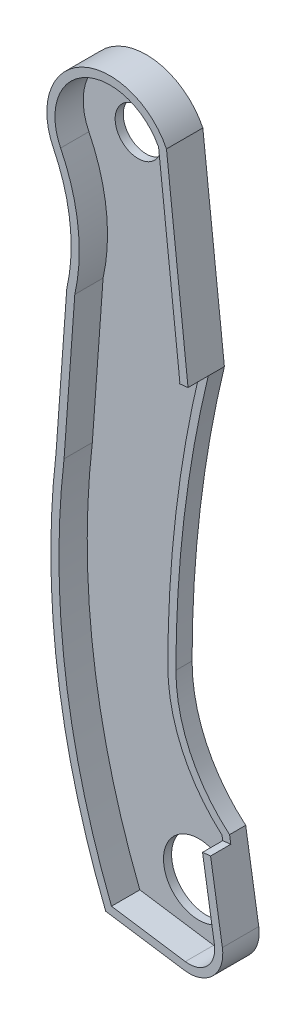
from build123d import *

# Parameters (mm, degrees)
BOSS_EXTRUDE1_DEPTH = 3.429
FILLET1_R           = 3.175
SHELL1_START        = 0.762
SHELL1_DEPTH        = 2.667
SKETCH2_R           = 2.1717
SKETCH2_R_2         = 3.3274
CUT_EXTRUDE1_DEPTH  = 109.116950745
SKETCH4_W           = 1.905
SKETCH4_H           = 37.1856
CUT_EXTRUDE3_DEPTH  = 8.509


# Read off the part's stored shape, not the designer's step: Shell1
with BuildPart() as part:
    # Sketch1 → Boss-Extrude1 (new body)
    with BuildSketch(Plane.XY):
        with BuildLine():
            Line((62.694975666, 80.659735828), (64.726975666, 62.193935828))
            ThreePointArc((64.726975666, 62.193935828), (62.449213934, 49.504733029), (61.678975666, 36.635747087))
            ThreePointArc((61.678975666, 36.635747087), (63.002494237, 30.6317877), (66.736169072, 25.747230203))
            Line((66.736169072, 25.747230203), (68.652274874, 13.809230203))
            Line((68.652274874, 13.809230203), (56.968274874, 15.553747087))
            ThreePointArc((56.968274874, 15.553747087), (52.42740055, 32.785925059), (52.280975666, 50.605747087))
            Line((52.280975666, 50.605747087), (53.296975666, 64.575747087))
            ThreePointArc((53.296975666, 64.575747087), (53.599423451, 70.100985632), (52.031009659, 75.407567754))
            ThreePointArc((52.031009659, 75.407567754), (54.734890855, 83.369731663), (62.694975666, 80.659735828))
        make_face()
    extrude(amount=BOSS_EXTRUDE1_DEPTH)

    # Fillet1
    fillet1_edges = [part.edges().sort_by_distance(p)[0] for p in [
        (68.652274874, 13.809230203, 1.7145),
    ]]
    fillet(fillet1_edges, radius=FILLET1_R)

    # Shell1 outline → Shell1 (cut)
    with BuildSketch(Plane.XY.offset(SHELL1_START)):
        with BuildLine():
            ThreePointArc((61.952685119, 80.438826605), (55.013786801, 82.65723656), (52.714338634, 75.744770233))
            ThreePointArc((52.714338634, 75.744770233), (54.352815027, 70.218797874), (54.052777411, 64.462848531))
            Line((54.052777411, 64.462848531), (53.039751684, 50.533744782))
            ThreePointArc((53.039751684, 50.533744782), (53.153060273, 33.111126197), (57.513949579, 16.242720176))
            Line((57.513949579, 16.242720176), (64.473451012, 15.203609619))
            ThreePointArc((64.473451012, 15.203609619), (66.545332993, 15.893259626), (67.212288081, 17.972558303))
            Line((67.212288081, 17.972558303), (66.027992544, 25.351127953))
            ThreePointArc((66.027992544, 25.351127953), (62.25173003, 30.440896905), (60.916975951, 36.636406417))
            ThreePointArc((60.916975951, 36.636406417), (61.6846952, 49.528718986), (63.955003411, 62.242759133))
            Line((63.955003411, 62.242759133), (61.952685119, 80.438826605))
        make_face()
    extrude(amount=SHELL1_DEPTH, mode=Mode.SUBTRACT)

    # Sketch2 → Cut-Extrude1 (cut, through all)
    with BuildSketch(Plane.XY.offset(3.429)):
        with Locations((57.360975666, 78.037747087)):
            Circle(SKETCH2_R)
        with Locations((63.072884184, 19.881317109)):
            Circle(SKETCH2_R_2)
    extrude(amount=-CUT_EXTRUDE1_DEPTH, mode=Mode.SUBTRACT)

    # Sketch4 → Cut-Extrude3 (cut)
    with BuildSketch(Plane(origin=(70.714586477, 7.781522583, 0), x_dir=(0, 0, -1), z_dir=(0.9939998970848155, 0.1093810065567881, 0))):
        with Locations((-2.4765, 36.148064063)):
            Rectangle(SKETCH4_W, SKETCH4_H)
    extrude(amount=-CUT_EXTRUDE3_DEPTH, mode=Mode.SUBTRACT)


solid = part.part
